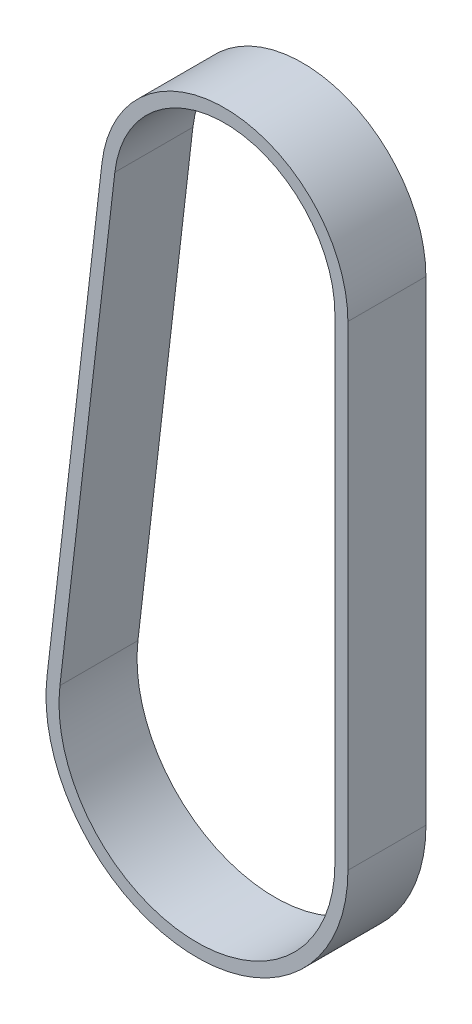
from build123d import *

# Parameters (mm, degrees)
EXTRUDE_THIN1_DEPTH = 9


with BuildPart() as part:
    # Sketch2 → Extrude-Thin1 (new body)
    with BuildSketch(Plane.XY):
        with BuildLine():
            Line((-17.298734404, 2.013263531), (-10.961976213, 56.461126551))
            ThreePointArc((-10.961976213, 56.461126551), (3.997978359, 69.024416617), (17.407395292, 54.817937968))
            Line((17.407395292, 54.817937968), (17.415494119, 0.002573094))
            ThreePointArc((17.415494119, 0.002573094), (-1.007038835, -17.38635427), (-17.298734404, 2.013263531))
        make_face()
        with BuildLine():
            Line((-15.808790958, 1.839860741), (-9.472032767, 56.287723761))
            ThreePointArc((-9.472032767, 56.287723761), (3.911241904, 67.526926455), (15.907395308, 54.817716347))
            Line((15.907395308, 54.817716347), (15.915494135, 0.002351473))
            ThreePointArc((15.915494135, 0.002351473), (-0.92030238, -15.888864108), (-15.808790958, 1.839860741))
        make_face(mode=Mode.SUBTRACT)
    extrude(amount=EXTRUDE_THIN1_DEPTH)


solid = part.part
